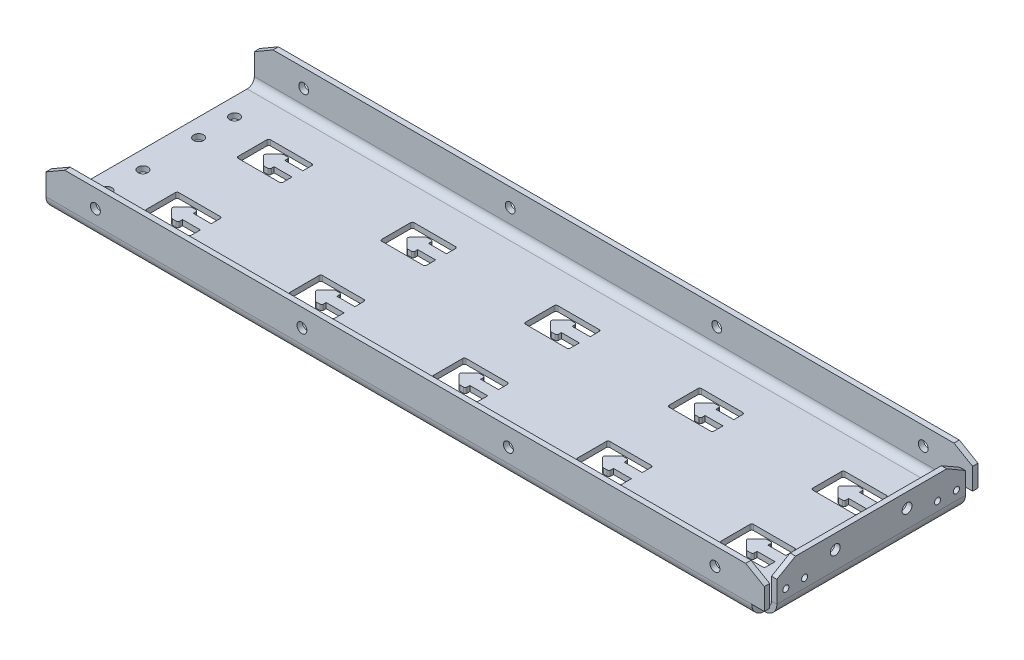
from build123d import *
from OCP.BRepFilletAPI import BRepFilletAPI_MakeChamfer

# Parameters (mm, degrees)
SZKIC1_W                         = 400
SZKIC1_H                         = 105
ODGI_CIE_BAZOWE1_DEPTH           = 3
ODGI_CIE_KRAW_DZI1_DEPTH         = 400
ODGI_CIE_KRAW_DZI1_BEND_DEPTH    = 400
OTW_R_POD_RUB_M51_D              = 5.5
WYTNIJ_WYCI_GNI_CIE1_REACH       = 211.82
ZAOKR_GLENIE1_R                  = 1
SZYK_LINIOWY1_COUNT              = 5
SZYK_LINIOWY1_PITCH              = 80
ZAOKR_GLENIE1_OF_SZYK_LINIOWY1_R = 1
LUSTRO3_START                    = -3
LUSTRO3_DEPTH                    = 3
OTW_R_POD_RUB_M52_D              = 5.5
OTW_R_POD_RUB_M52_DEPTH          = 10
OTW_R_POD_RUB_M52_TIP            = 1.652366702
ODGI_CIE_START                   = -59.5
ODGI_CIE_KRAW_DZI2_DEPTH         = 119
ODGI_CIE_KRAW_DZI2_2_DEPTH       = 7
ODGI_CIE_START_2                 = 52.5
ODGI_CIE_KRAW_DZI2_3_DEPTH       = 7
ODGI_CIE_START_3                 = -52.5
ODGI_CIE_KRAW_DZI2_4_DEPTH       = 105
SFAZOWANIE1_SIZE                 = 6
SFAZOWANIE1_SIZE2                = 10.392304845
OTW_R_POD_RUB_M31_D              = 3.4
OTW_R_POD_RUB_M31_DEPTH          = 10
OTW_R_POD_RUB_M31_TIP            = 1.021463052
OTW_R_POD_RUB_M53_D              = 5.5


# Read off the part's stored shape, not the designer's step: Lustro3, Odgięcie krawędzi2
# Sheet-metal steps are written as plain solids
with BuildPart() as part:
    # Szkic1 → Odgięcie bazowe1 (new body)
    with BuildSketch(Plane(origin=(0, 0, 0), x_dir=(1, 0, 0), z_dir=(0, 1, 0))):
        Rectangle(SZKIC1_W, SZKIC1_H)
    extrude(amount=-ODGI_CIE_BAZOWE1_DEPTH)

    # Odgięcie krawędzi1 section (across the edge) → Odgięcie krawędzi1 (add)
    with BuildSketch(Plane(origin=(-200, 0, 56.5), x_dir=(0, 0, -1), z_dir=(1, 0, 0))):
        with BuildLine():
            Line((-3, 4), (-3, 22))
            Line((-3, 22), (0, 22))
            Line((0, 22), (0, 4))
            ThreePointArc((0, 4), (1.171572875, 1.171572875), (4, 0))
            Line((4, 0), (4, -3))
            ThreePointArc((4, -3), (-0.949747468, -0.949747468), (-3, 4))
        make_face()
    extrude(amount=ODGI_CIE_KRAW_DZI1_DEPTH)

    # Odgięcie krawędzi1 section 2 (across the edge) → Odgięcie krawędzi1 bend (add)
    with BuildSketch(Plane(origin=(200, 0, -56.5), x_dir=(0, 0, 1), z_dir=(-1, 0, 0))):
        with BuildLine():
            Line((-3, 4), (-3, 22))
            Line((-3, 22), (0, 22))
            Line((0, 22), (0, 4))
            ThreePointArc((0, 4), (1.171572875, 1.171572875), (4, 0))
            Line((4, 0), (4, -3))
            ThreePointArc((4, -3), (-0.949747468, -0.949747468), (-3, 4))
        make_face()
    extrude(amount=ODGI_CIE_KRAW_DZI1_BEND_DEPTH)

    # Otwór pod śrubę M51 (through all)
    with Locations(Plane.XY.offset(59.5)):
        with Locations((-172.5, 12), (-57.5, 12), (57.5, 12), (172.5, 12)):
            Hole(OTW_R_POD_RUB_M51_D / 2)

    # Szkic10 → Wytnij-wyciągnięcie1 (cut, up to next)
    with BuildSketch(Plane(origin=(0, 0, 0), x_dir=(1, 0, 0), z_dir=(0, 1, 0)), mode=Mode.PRIVATE) as wytnij_wyci_gni_cie1_sk1:
        Polygon((-170, -16.5), (-145, -16.5), (-145, -22.5), (-155, -22.5), (-155, -20), (-158.5, -20), (-164, -25.5), (-158.5, -31), (-155, -31), (-155, -28.5), (-145, -28.5), (-145, -34.5), (-170, -34.5), align=None)
    wytnij_wyci_gni_cie1_tool1 = extrude(wytnij_wyci_gni_cie1_sk1.sketch, amount=-WYTNIJ_WYCI_GNI_CIE1_REACH, mode=Mode.PRIVATE) & part.part
    wytnij_wyci_gni_cie1 = wytnij_wyci_gni_cie1_tool1.solids().sort_by_distance((-157.5, 0, 16.808058))[0]
    add(wytnij_wyci_gni_cie1, mode=Mode.SUBTRACT)

    # Zaokrąglenie1
    zaokr_glenie1_edges = [part.edges().sort_by_distance(p)[0] for p in [
        (-170, -1.5, 34.5),
        (-170, -1.5, 16.5),
        (-145, -1.5, 16.5),
        (-155, -1.5, 20),
        (-158.5, -1.5, 20),
        (-164, -1.5, 25.5),
        (-158.5, -1.5, 31),
        (-155, -1.5, 31),
        (-145, -1.5, 34.5),
    ]]
    fillet(zaokr_glenie1_edges, radius=ZAOKR_GLENIE1_R)

    # Szyk liniowy1: Wytnij-wyciągnięcie1 ×5
    with Locations(*[(i * SZYK_LINIOWY1_PITCH, 0, 0) for i in range(1, SZYK_LINIOWY1_COUNT)]):
        add(wytnij_wyci_gni_cie1, mode=Mode.SUBTRACT)

    # Zaokrąglenie1 of Szyk liniowy1
    zaokr_glenie1_of_szyk_liniowy1_edges = [part.edges().sort_by_distance(p)[0] for p in [
        (-90, -1.5, 34.5),
        (-90, -1.5, 16.5),
        (-65, -1.5, 16.5),
        (-75, -1.5, 20),
        (-78.5, -1.5, 20),
        (-84, -1.5, 25.5),
        (-78.5, -1.5, 31),
        (-75, -1.5, 31),
        (-65, -1.5, 34.5),
        (-10, -1.5, 34.5),
        (-10, -1.5, 16.5),
        (15, -1.5, 16.5),
        (5, -1.5, 20),
        (1.5, -1.5, 20),
        (-4, -1.5, 25.5),
        (1.5, -1.5, 31),
        (5, -1.5, 31),
        (15, -1.5, 34.5),
        (70, -1.5, 34.5),
        (70, -1.5, 16.5),
        (95, -1.5, 16.5),
        (85, -1.5, 20),
        (81.5, -1.5, 20),
        (76, -1.5, 25.5),
        (81.5, -1.5, 31),
        (85, -1.5, 31),
        (95, -1.5, 34.5),
        (150, -1.5, 34.5),
        (150, -1.5, 16.5),
        (175, -1.5, 16.5),
        (165, -1.5, 20),
        (161.5, -1.5, 20),
        (156, -1.5, 25.5),
        (161.5, -1.5, 31),
        (165, -1.5, 31),
        (175, -1.5, 34.5),
    ]]
    fillet(zaokr_glenie1_of_szyk_liniowy1_edges, radius=ZAOKR_GLENIE1_OF_SZYK_LINIOWY1_R)

    # Lustro3 outline → Lustro3 (cut)
    with BuildSketch(Plane(origin=(0, 0, 0), x_dir=(1, 0, 0), z_dir=(0, 1, 0)).offset(LUSTRO3_START)):
        with BuildLine():
            Line((165, 30), (165, 28.5))
            Line((165, 28.5), (175, 28.5))
            Line((175, 28.5), (175, 33.5))
            ThreePointArc((175, 33.5), (174.707106781, 34.207106781), (174, 34.5))
            Line((174, 34.5), (151, 34.5))
            ThreePointArc((151, 34.5), (150.292893219, 34.207106781), (150, 33.5))
            Line((150, 33.5), (150, 17.5))
            ThreePointArc((150, 17.5), (150.292893219, 16.792893219), (151, 16.5))
            Line((151, 16.5), (174, 16.5))
            ThreePointArc((174, 16.5), (174.707106781, 16.792893219), (175, 17.5))
            Line((175, 17.5), (175, 22.5))
            Line((175, 22.5), (165, 22.5))
            Line((165, 22.5), (165, 21))
            ThreePointArc((165, 21), (164.707106781, 20.292893219), (164, 20))
            Line((164, 20), (161.914213562, 20))
            ThreePointArc((161.914213562, 20), (161.53153013, 20.076120467), (161.207106781, 20.292893219))
            Line((161.207106781, 20.292893219), (156.707106781, 24.792893219))
            ThreePointArc((156.707106781, 24.792893219), (156.414213562, 25.5), (156.707106781, 26.207106781))
            Line((156.707106781, 26.207106781), (161.207106781, 30.707106781))
            ThreePointArc((161.207106781, 30.707106781), (161.53153013, 30.923879533), (161.914213562, 31))
            Line((161.914213562, 31), (164, 31))
            ThreePointArc((164, 31), (164.707106781, 30.707106781), (165, 30))
        make_face()
        with BuildLine():
            Line((85, 30), (85, 28.5))
            Line((85, 28.5), (95, 28.5))
            Line((95, 28.5), (95, 33.5))
            ThreePointArc((95, 33.5), (94.707106781, 34.207106781), (94, 34.5))
            Line((94, 34.5), (71, 34.5))
            ThreePointArc((71, 34.5), (70.292893219, 34.207106781), (70, 33.5))
            Line((70, 33.5), (70, 17.5))
            ThreePointArc((70, 17.5), (70.292893219, 16.792893219), (71, 16.5))
            Line((71, 16.5), (94, 16.5))
            ThreePointArc((94, 16.5), (94.707106781, 16.792893219), (95, 17.5))
            Line((95, 17.5), (95, 22.5))
            Line((95, 22.5), (85, 22.5))
            Line((85, 22.5), (85, 21))
            ThreePointArc((85, 21), (84.707106781, 20.292893219), (84, 20))
            Line((84, 20), (81.914213562, 20))
            ThreePointArc((81.914213562, 20), (81.53153013, 20.076120467), (81.207106781, 20.292893219))
            Line((81.207106781, 20.292893219), (76.707106781, 24.792893219))
            ThreePointArc((76.707106781, 24.792893219), (76.414213562, 25.5), (76.707106781, 26.207106781))
            Line((76.707106781, 26.207106781), (81.207106781, 30.707106781))
            ThreePointArc((81.207106781, 30.707106781), (81.53153013, 30.923879533), (81.914213562, 31))
            Line((81.914213562, 31), (84, 31))
            ThreePointArc((84, 31), (84.707106781, 30.707106781), (85, 30))
        make_face()
        with BuildLine():
            Line((5, 30), (5, 28.5))
            Line((5, 28.5), (15, 28.5))
            Line((15, 28.5), (15, 33.5))
            ThreePointArc((15, 33.5), (14.707106781, 34.207106781), (14, 34.5))
            Line((14, 34.5), (-9, 34.5))
            ThreePointArc((-9, 34.5), (-9.707106781, 34.207106781), (-10, 33.5))
            Line((-10, 33.5), (-10, 17.5))
            ThreePointArc((-10, 17.5), (-9.707106781, 16.792893219), (-9, 16.5))
            Line((-9, 16.5), (14, 16.5))
            ThreePointArc((14, 16.5), (14.707106781, 16.792893219), (15, 17.5))
            Line((15, 17.5), (15, 22.5))
            Line((15, 22.5), (5, 22.5))
            Line((5, 22.5), (5, 21))
            ThreePointArc((5, 21), (4.707106781, 20.292893219), (4, 20))
            Line((4, 20), (1.914213562, 20))
            ThreePointArc((1.914213562, 20), (1.53153013, 20.076120467), (1.207106781, 20.292893219))
            Line((1.207106781, 20.292893219), (-3.292893219, 24.792893219))
            ThreePointArc((-3.292893219, 24.792893219), (-3.585786438, 25.5), (-3.292893219, 26.207106781))
            Line((-3.292893219, 26.207106781), (1.207106781, 30.707106781))
            ThreePointArc((1.207106781, 30.707106781), (1.53153013, 30.923879533), (1.914213562, 31))
            Line((1.914213562, 31), (4, 31))
            ThreePointArc((4, 31), (4.707106781, 30.707106781), (5, 30))
        make_face()
        with BuildLine():
            Line((-170, 33.5), (-170, 17.5))
            ThreePointArc((-170, 17.5), (-169.707106781, 16.792893219), (-169, 16.5))
            Line((-169, 16.5), (-146, 16.5))
            ThreePointArc((-146, 16.5), (-145.292893219, 16.792893219), (-145, 17.5))
            Line((-145, 17.5), (-145, 22.5))
            Line((-145, 22.5), (-155, 22.5))
            Line((-155, 22.5), (-155, 21))
            ThreePointArc((-155, 21), (-155.292893219, 20.292893219), (-156, 20))
            Line((-156, 20), (-158.085786438, 20))
            ThreePointArc((-158.085786438, 20), (-158.46846987, 20.076120467), (-158.792893219, 20.292893219))
            Line((-158.792893219, 20.292893219), (-163.292893219, 24.792893219))
            ThreePointArc((-163.292893219, 24.792893219), (-163.585786438, 25.5), (-163.292893219, 26.207106781))
            Line((-163.292893219, 26.207106781), (-158.792893219, 30.707106781))
            ThreePointArc((-158.792893219, 30.707106781), (-158.46846987, 30.923879533), (-158.085786438, 31))
            Line((-158.085786438, 31), (-156, 31))
            ThreePointArc((-156, 31), (-155.292893219, 30.707106781), (-155, 30))
            Line((-155, 30), (-155, 28.5))
            Line((-155, 28.5), (-145, 28.5))
            Line((-145, 28.5), (-145, 33.5))
            ThreePointArc((-145, 33.5), (-145.292893219, 34.207106781), (-146, 34.5))
            Line((-146, 34.5), (-169, 34.5))
            ThreePointArc((-169, 34.5), (-169.707106781, 34.207106781), (-170, 33.5))
        make_face()
        with BuildLine():
            Line((-75, 30), (-75, 28.5))
            Line((-75, 28.5), (-65, 28.5))
            Line((-65, 28.5), (-65, 33.5))
            ThreePointArc((-65, 33.5), (-65.292893219, 34.207106781), (-66, 34.5))
            Line((-66, 34.5), (-89, 34.5))
            ThreePointArc((-89, 34.5), (-89.707106781, 34.207106781), (-90, 33.5))
            Line((-90, 33.5), (-90, 17.5))
            ThreePointArc((-90, 17.5), (-89.707106781, 16.792893219), (-89, 16.5))
            Line((-89, 16.5), (-66, 16.5))
            ThreePointArc((-66, 16.5), (-65.292893219, 16.792893219), (-65, 17.5))
            Line((-65, 17.5), (-65, 22.5))
            Line((-65, 22.5), (-75, 22.5))
            Line((-75, 22.5), (-75, 21))
            ThreePointArc((-75, 21), (-75.292893219, 20.292893219), (-76, 20))
            Line((-76, 20), (-78.085786438, 20))
            ThreePointArc((-78.085786438, 20), (-78.46846987, 20.076120467), (-78.792893219, 20.292893219))
            Line((-78.792893219, 20.292893219), (-83.292893219, 24.792893219))
            ThreePointArc((-83.292893219, 24.792893219), (-83.585786438, 25.5), (-83.292893219, 26.207106781))
            Line((-83.292893219, 26.207106781), (-78.792893219, 30.707106781))
            ThreePointArc((-78.792893219, 30.707106781), (-78.46846987, 30.923879533), (-78.085786438, 31))
            Line((-78.085786438, 31), (-76, 31))
            ThreePointArc((-76, 31), (-75.292893219, 30.707106781), (-75, 30))
        make_face()
    extrude(amount=LUSTRO3_DEPTH, mode=Mode.SUBTRACT)

    # Otwór pod śrubę M52
    with Locations(Plane(origin=(0, 0, 0), x_dir=(1, 0, 0), z_dir=(0, 1, 0))):
        with Locations((-190, 35.5), (-190, 15.5), (-190, -15.5), (-190, -35.5)):
            Hole(OTW_R_POD_RUB_M52_D / 2, depth=OTW_R_POD_RUB_M52_DEPTH)
            with Locations((0, 0, -(OTW_R_POD_RUB_M52_DEPTH + OTW_R_POD_RUB_M52_TIP / 2))):  # 118° drill point
                Cone(0, OTW_R_POD_RUB_M52_D / 2, OTW_R_POD_RUB_M52_TIP, mode=Mode.SUBTRACT)

    # Odgięcie krawędzi2 outline → Odgięcie krawędzi2 (cut)
    with BuildSketch(Plane.XY.offset(ODGI_CIE_START)):
        with BuildLine():
            Line((197, 4), (193, 4))
            Line((193, 4), (193, 0))
            ThreePointArc((193, 0), (195.828427125, 1.171572875), (197, 4))
        make_face()
        with BuildLine():
            ThreePointArc((200, 4), (197.949747468, -0.949747468), (193, -3))
            Line((193, -3), (200, -3))
            Line((200, -3), (200, 4))
        make_face()
    extrude(amount=ODGI_CIE_KRAW_DZI2_DEPTH, mode=Mode.SUBTRACT)

    # Odgi_cie kraw_dzi2 2 outline → Odgi_cie kraw_dzi2 2 (cut)
    with BuildSketch(Plane.XY.offset(ODGI_CIE_START)):
        with BuildLine():
            Line((200, 4), (197, 4))
            ThreePointArc((197, 4), (195.828427125, 1.171572875), (193, 0))
            Line((193, 0), (193, -3))
            ThreePointArc((193, -3), (197.949747468, -0.949747468), (200, 4))
        make_face()
    extrude(amount=ODGI_CIE_KRAW_DZI2_2_DEPTH, mode=Mode.SUBTRACT)

    # Odgi_cie kraw_dzi2 3 outline → Odgi_cie kraw_dzi2 3 (cut)
    with BuildSketch(Plane.XY.offset(ODGI_CIE_START_2)):
        with BuildLine():
            Line((200, 4), (197, 4))
            ThreePointArc((197, 4), (195.828427125, 1.171572875), (193, 0))
            Line((193, 0), (193, -3))
            ThreePointArc((193, -3), (197.949747468, -0.949747468), (200, 4))
        make_face()
    extrude(amount=ODGI_CIE_KRAW_DZI2_3_DEPTH, mode=Mode.SUBTRACT)

    # Odgi_cie kraw_dzi2 4 outline → Odgi_cie kraw_dzi2 4 (add)
    with BuildSketch(Plane.XY.offset(ODGI_CIE_START_3)):
        with BuildLine():
            Line((197, 22), (197, 4))
            ThreePointArc((197, 4), (195.828427125, 1.171572875), (193, 0))
            Line((193, 0), (198.744562646, 0))
            ThreePointArc((198.744562646, 0), (199.678770041, 1.903805654), (200, 4))
            Line((200, 4), (200, 22))
            Line((200, 22), (197, 22))
        make_face()
    extrude(amount=ODGI_CIE_KRAW_DZI2_4_DEPTH)

    # Sfazowanie1: one chamfer whose edges measure the first distance from different faces: ONE call of the kernel's chamfer builder (chamfer() names one face for all edges)
    sfazowanie1_edges_1 = [part.edges().sort_by_distance(p)[0] for p in [
        (200, 22, -58),
    ]]
    sfazowanie1_side_1 = [part.faces().sort_by_distance(p)[0] for p in [
        (200, 13, -58),
    ]]
    sfazowanie1_edges_2 = [part.edges().sort_by_distance(p)[0] for p in [
        (200, 22, 58),
    ]]
    sfazowanie1_side_2 = [part.faces().sort_by_distance(p)[0] for p in [
        (200, 13, 58),
    ]]
    sfazowanie1_edges_3 = [part.edges().sort_by_distance(p)[0] for p in [
        (-200, 22, -58),
        (-200, 22, 58),
    ]]
    sfazowanie1_side_3 = [part.faces().sort_by_distance(p)[0] for p in [
        (-200, -1.215976973, 0),
    ]]
    sfazowanie1_edges_4 = [part.edges().sort_by_distance(p)[0] for p in [
        (198.5, 22, 52.5),
    ]]
    sfazowanie1_side_4 = [part.faces().sort_by_distance(p)[0] for p in [
        (197.87999349, 8.917531902, 52.5),
    ]]
    sfazowanie1_edges_5 = [part.edges().sort_by_distance(p)[0] for p in [
        (198.5, 22, -52.5),
    ]]
    sfazowanie1_side_5 = [part.faces().sort_by_distance(p)[0] for p in [
        (197.87999349, 8.917531902, -52.5),
    ]]
    sfazowanie1 = BRepFilletAPI_MakeChamfer(part.part.solid().wrapped)
    for e in sfazowanie1_edges_1:
        sfazowanie1.Add(SFAZOWANIE1_SIZE, SFAZOWANIE1_SIZE2, e.wrapped, sfazowanie1_side_1[0].wrapped)  # the first distance lies on this face
    for e in sfazowanie1_edges_2:
        sfazowanie1.Add(SFAZOWANIE1_SIZE, SFAZOWANIE1_SIZE2, e.wrapped, sfazowanie1_side_2[0].wrapped)  # the first distance lies on this face
    for e in sfazowanie1_edges_3:
        sfazowanie1.Add(SFAZOWANIE1_SIZE, SFAZOWANIE1_SIZE2, e.wrapped, sfazowanie1_side_3[0].wrapped)  # the first distance lies on this face
    for e in sfazowanie1_edges_4:
        sfazowanie1.Add(SFAZOWANIE1_SIZE, SFAZOWANIE1_SIZE2, e.wrapped, sfazowanie1_side_4[0].wrapped)  # the first distance lies on this face
    for e in sfazowanie1_edges_5:
        sfazowanie1.Add(SFAZOWANIE1_SIZE, SFAZOWANIE1_SIZE2, e.wrapped, sfazowanie1_side_5[0].wrapped)  # the first distance lies on this face
    add(Compound.cast(sfazowanie1.Shape()), mode=Mode.REPLACE)

    # Otwór pod śrubę M31
    with Locations(Plane(origin=(200, 0, 0), x_dir=(0, 0, -1), z_dir=(1, 0, 0))):
        with Locations((-47.5, 9), (-37, 9), (37, 9), (47.5, 9)):
            Hole(OTW_R_POD_RUB_M31_D / 2, depth=OTW_R_POD_RUB_M31_DEPTH)
            with Locations((0, 0, -(OTW_R_POD_RUB_M31_DEPTH + OTW_R_POD_RUB_M31_TIP / 2))):  # 118° drill point
                Cone(0, OTW_R_POD_RUB_M31_D / 2, OTW_R_POD_RUB_M31_TIP, mode=Mode.SUBTRACT)

    # Otwór pod śrubę M53 (through all)
    with Locations(Plane.ZY.offset(-197)):
        with Locations((-20, 14), (20, 14)):
            Hole(OTW_R_POD_RUB_M53_D / 2)


solid = part.part
